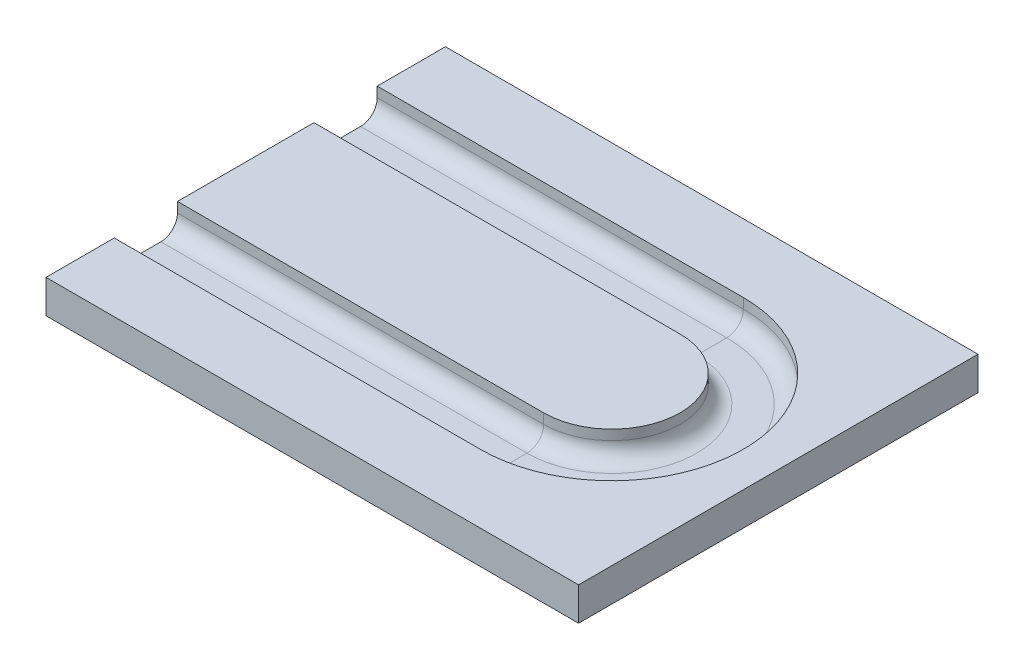
from build123d import *

# Parameters (mm, degrees)
SKETCH1_W            = 101.6
SKETCH1_H            = 76.2
BASE_PLATE_DEPTH     = 6.35
PIPE_START           = -50.8
PIPE_PROFILE_DEPTH   = 69.85
PIPE_PROFILE_2_ANGLE = 180


with BuildPart() as part:
    # Sketch1 → Base Plate (new body)
    with BuildSketch(Plane(origin=(0, 0, 0), x_dir=(1, 0, 0), z_dir=(0, 1, 0))):
        Rectangle(SKETCH1_W, SKETCH1_H)
    extrude(amount=BASE_PLATE_DEPTH)

    # Pipe Profile: read off the stored shape, not the designer's step
    # Pipe Profile outline → Pipe Profile (cut)
    with BuildSketch(Plane.YZ.offset(PIPE_START)):
        with BuildLine():
            Line((6.35, 25.0825), (4.445, 25.0825))
            ThreePointArc((4.445, 25.0825), (2.19993597, 24.15256403), (1.27, 21.9075))
            Line((1.27, 21.9075), (1.27, 16.1925))
            ThreePointArc((1.27, 16.1925), (2.19993597, 13.94743597), (4.445, 13.0175))
            Line((4.445, 13.0175), (6.35, 13.0175))
            Line((6.35, 13.0175), (6.35, 25.0825))
        make_face()
        with BuildLine():
            Line((6.35, -25.0825), (6.35, -13.0175))
            Line((6.35, -13.0175), (4.445, -13.0175))
            ThreePointArc((4.445, -13.0175), (2.19993597, -13.94743597), (1.27, -16.1925))
            Line((1.27, -16.1925), (1.27, -21.9075))
            ThreePointArc((1.27, -21.9075), (2.19993597, -24.15256403), (4.445, -25.0825))
            Line((4.445, -25.0825), (6.35, -25.0825))
        make_face()
    extrude(amount=PIPE_PROFILE_DEPTH, mode=Mode.SUBTRACT)

    # Pipe Profile 2 outline → Pipe Profile 2 (revolve, cut)
    with BuildSketch(Plane.ZY.offset(-19.05)):
        with BuildLine():
            ThreePointArc((13.0175, 4.445), (13.94743597, 2.19993597), (16.1925, 1.27))
            Line((16.1925, 1.27), (21.9075, 1.27))
            ThreePointArc((21.9075, 1.27), (24.15256403, 2.19993597), (25.0825, 4.445))
            Line((25.0825, 4.445), (25.0825, 6.35))
            Line((25.0825, 6.35), (13.0175, 6.35))
            Line((13.0175, 6.35), (13.0175, 4.445))
        make_face()
    revolve(axis=Axis((19.05, 0, 0), (0, 1, 0)), revolution_arc=PIPE_PROFILE_2_ANGLE, mode=Mode.SUBTRACT)


solid = part.part
